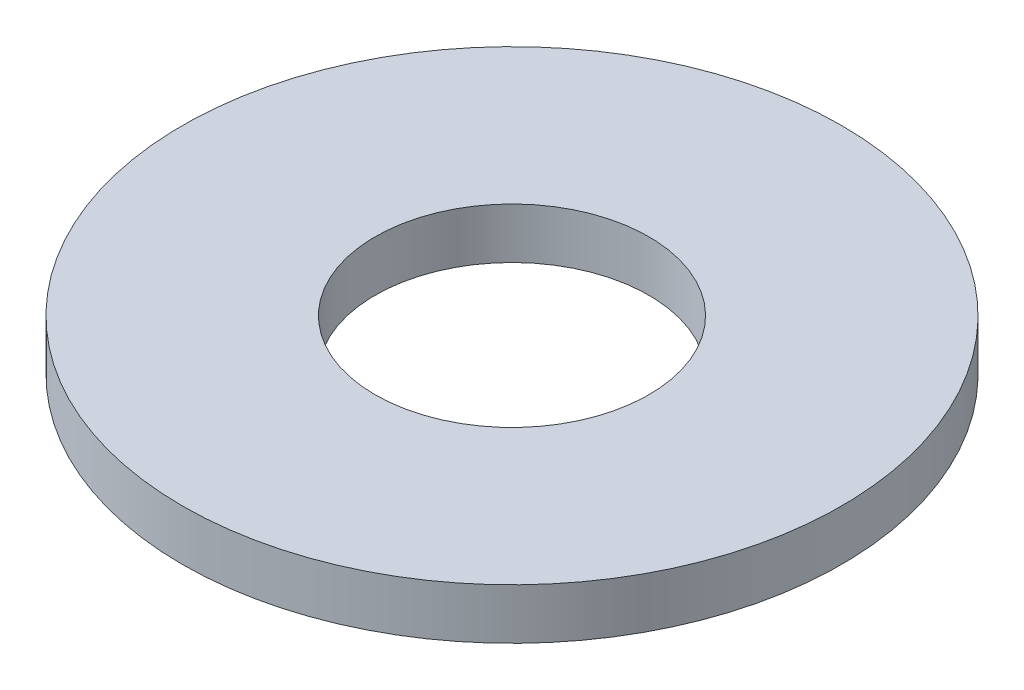
from build123d import *

# Parameters (mm, degrees)
ESQUISSE1_R        = 3.25
ESQUISSE1_R_2      = 1.35
BOSS_EXTRU_1_DEPTH = 0.25


with BuildPart() as part:
    # Esquisse1 → Boss.-Extru.1 (new, symmetric)
    with BuildSketch(Plane(origin=(0, 0, 0), x_dir=(1, 0, 0), z_dir=(0, 1, 0))):
        Circle(ESQUISSE1_R)
        Circle(ESQUISSE1_R_2, mode=Mode.SUBTRACT)
    extrude(amount=BOSS_EXTRU_1_DEPTH, both=True)


solid = part.part
